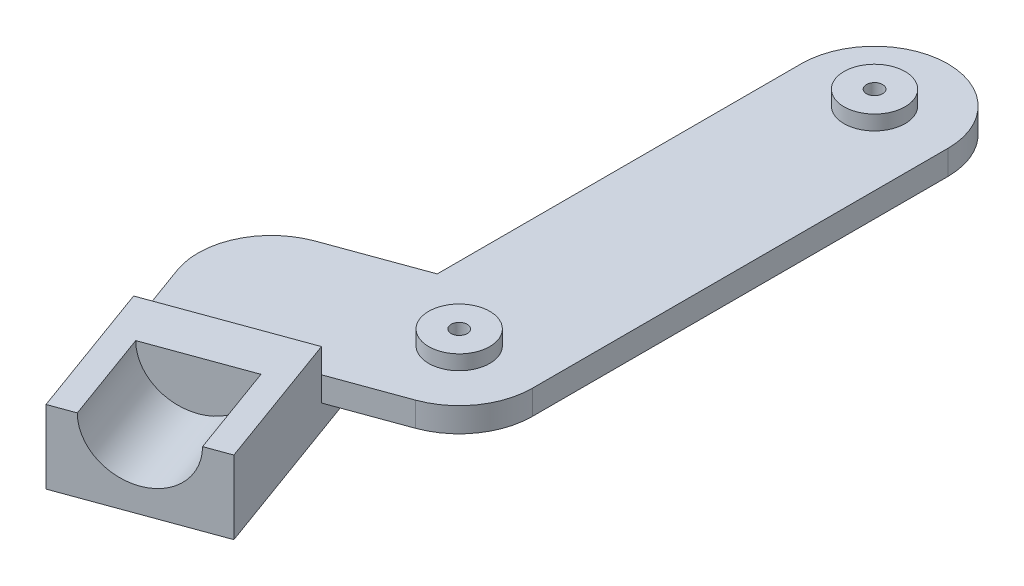
from build123d import *

# Parameters (mm, degrees)
EXTRUDE_1_DEPTH        = 5
SKETCH_2_R             = 6.25
EXTRUDE_2_DEPTH        = 3
HOLE_WIZARD_M4_1_D     = 3.3
HOLE_WIZARD_M4_1_DEPTH = 5
HOLE_WIZARD_M4_1_TIP   = 0.991420021
EXTRUDE_3_DEPTH        = 5
EXTRUDE_4_DEPTH        = 5
EXTRUDE_4_DEPTH_BACK   = 5
EXTRUDE_5_DEPTH        = 5
SKETCH_12_R            = 10
CUT_EXTRUDE_1_DEPTH    = 20


with BuildPart() as part:
    # 스케치1 → 보스-돌출1 (new body)
    with BuildSketch(Plane(origin=(0, 0, 0), x_dir=(1, 0, 0), z_dir=(0, 1, 0))):
        with BuildLine():
            Line((-15, 0), (-15, 85))
            ThreePointArc((-15, 85), (0, 100), (15, 85))
            Line((15, 85), (15, 0))
            ThreePointArc((15, 0), (0, -15), (-15, 0))
        make_face()
    extrude(amount=EXTRUDE_1_DEPTH)

    # 스케치2 → 보스-돌출2 (add)
    with BuildSketch(Plane(origin=(0, 5, 0), x_dir=(1, 0, 0), z_dir=(0, 1, 0))):
        with Locations((0, 85)):
            Circle(SKETCH_2_R)
        Circle(SKETCH_2_R)
    extrude(amount=EXTRUDE_2_DEPTH)

    # M4 탭을 위한 탭 드릴1
    with Locations(Plane(origin=(0, 8, 0), x_dir=(1, 0, 0), z_dir=(0, 1, 0))):
        with Locations((0, 0), (0, 85)):
            Hole(HOLE_WIZARD_M4_1_D / 2, depth=HOLE_WIZARD_M4_1_DEPTH)
            with Locations((0, 0, -(HOLE_WIZARD_M4_1_DEPTH + HOLE_WIZARD_M4_1_TIP / 2))):  # 118° drill point
                Cone(0, HOLE_WIZARD_M4_1_D / 2, HOLE_WIZARD_M4_1_TIP, mode=Mode.SUBTRACT)

    # 스케치9 → 보스-돌출3 (add)
    with BuildSketch(Plane.XZ):
        with BuildLine():
            Line((-5.13030215, -14.095389312), (-33.321080773, -3.834785012))
            ThreePointArc((-33.321080773, -3.834785012), (-42.286167935, 15.39090645), (-23.060476474, 24.355993612))
            Line((-23.060476474, 24.355993612), (5.13030215, 14.095389312))
            ThreePointArc((5.13030215, 14.095389312), (14.095389312, -5.13030215), (-5.13030215, -14.095389312))
        make_face()
    extrude(amount=-EXTRUDE_3_DEPTH)

    # 스케치10 → 보스-돌출4 (add, two sides: drawn at the far end of the back side and taken through both)
    with BuildSketch(Plane.XZ.offset(-EXTRUDE_4_DEPTH_BACK)):
        with BuildLine():
            Line((-42.286167935, 15.39090645), (-26.895261486, 57.677074385))
            Line((-26.895261486, 57.677074385), (1.295517138, 47.416470085))
            Line((1.295517138, 47.416470085), (-14.095389312, 5.13030215))
            ThreePointArc((-14.095389312, 5.13030215), (-33.321080773, -3.834785012), (-42.286167935, 15.39090645))
        make_face()
    extrude(amount=EXTRUDE_4_DEPTH + EXTRUDE_4_DEPTH_BACK)

    # 스케치11 → 보스-돌출5 (add)
    with BuildSketch(Plane(origin=(0, 5, 0), x_dir=(1, 0, 0), z_dir=(0, 1, 0))):
        Polygon((-26.895261486, -57.677074385), (-37.155865785, -29.486295761), (-8.965087162, -19.225691462), (1.295517138, -47.416470085), align=None)
    extrude(amount=EXTRUDE_5_DEPTH)

    # 스케치12 → 컷-돌출1 (cut)
    with BuildSketch(Plane(origin=(15.39090645, 0, 42.286167935), x_dir=(0.9396926207859109, 0, -0.342020143325662), z_dir=(0.342020143325662, 0, 0.9396926207859109))):
        with Locations((-30, 10)):
            Circle(SKETCH_12_R)
    extrude(amount=-CUT_EXTRUDE_1_DEPTH, mode=Mode.SUBTRACT)


solid = part.part
